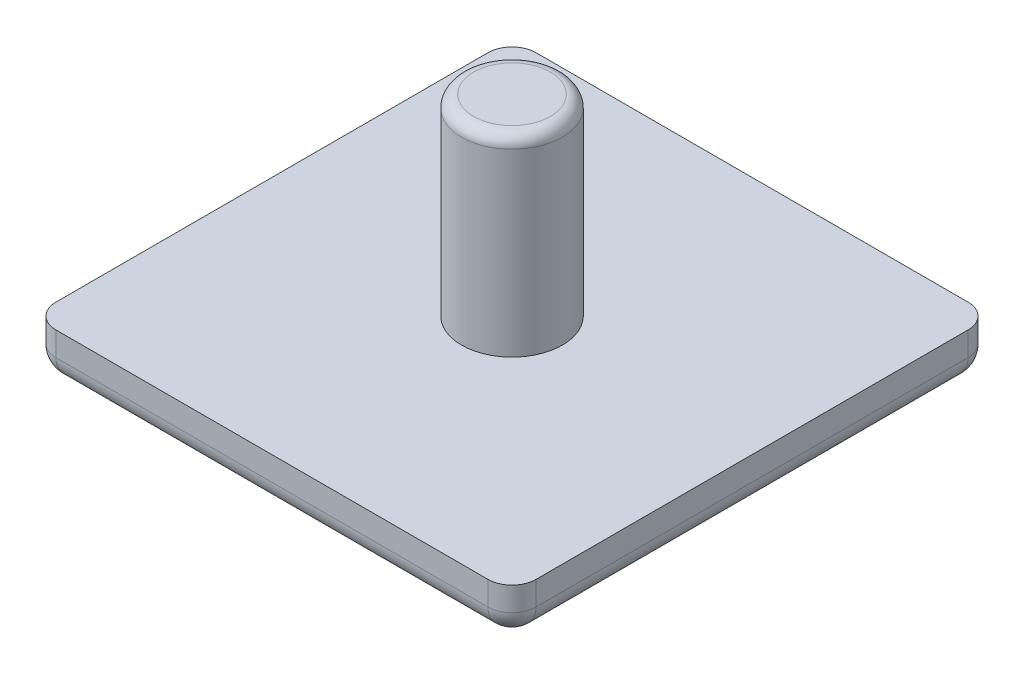
from build123d import *

# Parameters (mm, degrees)
SKETCH1_R           = 2.1
BOSS_EXTRUDE1_DEPTH = 8
SKETCH2_W           = 20
SKETCH2_H           = 20
BOSS_EXTRUDE2_DEPTH = 2
FILLET1_R           = 1
FILLET2_R           = 0.5
FILLET3_R           = 1


with BuildPart() as part:
    # Sketch1 → Boss-Extrude1 (new body)
    with BuildSketch(Plane(origin=(0, 0, 0), x_dir=(1, 0, 0), z_dir=(0, 1, 0))):
        with Locations(Location((10, 10, 0), (0, 0, 270))):
            Circle(SKETCH1_R)
    extrude(amount=BOSS_EXTRUDE1_DEPTH)

    # Sketch2 → Boss-Extrude2 (add)
    with BuildSketch(Plane.XZ):
        with Locations((10, -10)):
            Rectangle(SKETCH2_W, SKETCH2_H)
    extrude(amount=BOSS_EXTRUDE2_DEPTH)

    # Fillet1
    fillet1_edges = [part.edges().sort_by_distance(p)[0] for p in [
        (0, -2, -10),
        (10, -2, -20),
        (20, -2, -10),
        (10, -2, 0),
    ]]
    fillet(fillet1_edges, radius=FILLET1_R)

    # Fillet2
    fillet2_edges = [part.edges().sort_by_distance(p)[0] for p in [
        (10, 8, -12.1),
    ]]
    fillet(fillet2_edges, radius=FILLET2_R)

    # Fillet3
    # the kernel refuses this fillet: 1 mm, written as the material it takes off along each edge
    with BuildSketch(Plane(origin=(19, -1, -19), x_dir=(0, 0, -1), z_dir=(1, 0, 0))) as fillet3_piece_1_section:
        Polygon((0, 0), (FILLET3_R, 0), (FILLET3_R, -FILLET3_R), (0, -FILLET3_R), align=None)
    fillet3_piece_1 = extrude(amount=FILLET3_R, mode=Mode.PRIVATE)
    fillet3_piece_1 = fillet3_piece_1 - Plane(origin=(19, -1, -19), x_dir=(0, 0.7071067811865475, 0.7071067811865475), z_dir=(1, 0, 0)) * Sphere(FILLET3_R, mode=Mode.PRIVATE)
    add(fillet3_piece_1, mode=Mode.SUBTRACT)
    with BuildSketch(Plane(origin=(1, -1, -19), x_dir=(0, 0, -1), z_dir=(-1, 0, 0))) as fillet3_piece_2_section:
        Polygon((0, 0), (FILLET3_R, 0), (FILLET3_R, FILLET3_R), (0, FILLET3_R), align=None)
    fillet3_piece_2 = extrude(amount=FILLET3_R, mode=Mode.PRIVATE)
    fillet3_piece_2 = fillet3_piece_2 - Plane(origin=(1, -1, -19), x_dir=(0, 0.7071067811865475, 0.7071067811865475), z_dir=(-1, 0, 0)) * Sphere(FILLET3_R, mode=Mode.PRIVATE)
    add(fillet3_piece_2, mode=Mode.SUBTRACT)
    with BuildSketch(Plane(origin=(19, -1, -1), x_dir=(1, 0, 0), z_dir=(0, 0, 1))) as fillet3_piece_3_section:
        Polygon((0, 0), (FILLET3_R, 0), (FILLET3_R, -FILLET3_R), (0, -FILLET3_R), align=None)
    fillet3_piece_3 = extrude(amount=FILLET3_R, mode=Mode.PRIVATE)
    fillet3_piece_3 = fillet3_piece_3 - Plane(origin=(19, -1, -1), x_dir=(-0.7071067811865475, 0.7071067811865475, 0), z_dir=(0, 0, 1)) * Sphere(FILLET3_R, mode=Mode.PRIVATE)
    add(fillet3_piece_3, mode=Mode.SUBTRACT)
    with BuildSketch(Plane(origin=(1, -1, -1), x_dir=(-1, 0, 0), z_dir=(0, 0, 1))) as fillet3_piece_4_section:
        Polygon((0, 0), (FILLET3_R, 0), (FILLET3_R, FILLET3_R), (0, FILLET3_R), align=None)
    fillet3_piece_4 = extrude(amount=FILLET3_R, mode=Mode.PRIVATE)
    fillet3_piece_4 = fillet3_piece_4 - Plane(origin=(1, -1, -1), x_dir=(0.7071067811865475, 0.7071067811865475, 0), z_dir=(0, 0, 1)) * Sphere(FILLET3_R, mode=Mode.PRIVATE)
    add(fillet3_piece_4, mode=Mode.SUBTRACT)
    with BuildSketch(Plane(origin=(0, 2.5, 0), x_dir=(1, 0, 0), z_dir=(0, -1, 0)), Plane(origin=(0, 2.5, -20), x_dir=(0, 0, 1), z_dir=(0, -1, 0))) as fillet3_piece_5:
        with BuildLine():
            CenterArc((FILLET3_R, -FILLET3_R), FILLET3_R, 90, 90)
            Line((0, -FILLET3_R), (0, 0))
            Line((0, 0), (FILLET3_R, 0))
        make_face()
    extrude(amount=3.5, mode=Mode.SUBTRACT)
    with BuildSketch(Plane(origin=(20, 2.5, 0), x_dir=(-1, 0, 0), z_dir=(0, -1, 0)), Plane(origin=(20, 2.5, -20), x_dir=(0, 0, 1), z_dir=(0, -1, 0))) as fillet3_piece_6:
        with BuildLine():
            CenterArc((FILLET3_R, FILLET3_R), FILLET3_R, 180, 90)
            Line((0, FILLET3_R), (0, 0))
            Line((0, 0), (FILLET3_R, 0))
        make_face()
    extrude(amount=3.5, mode=Mode.SUBTRACT)


solid = part.part
